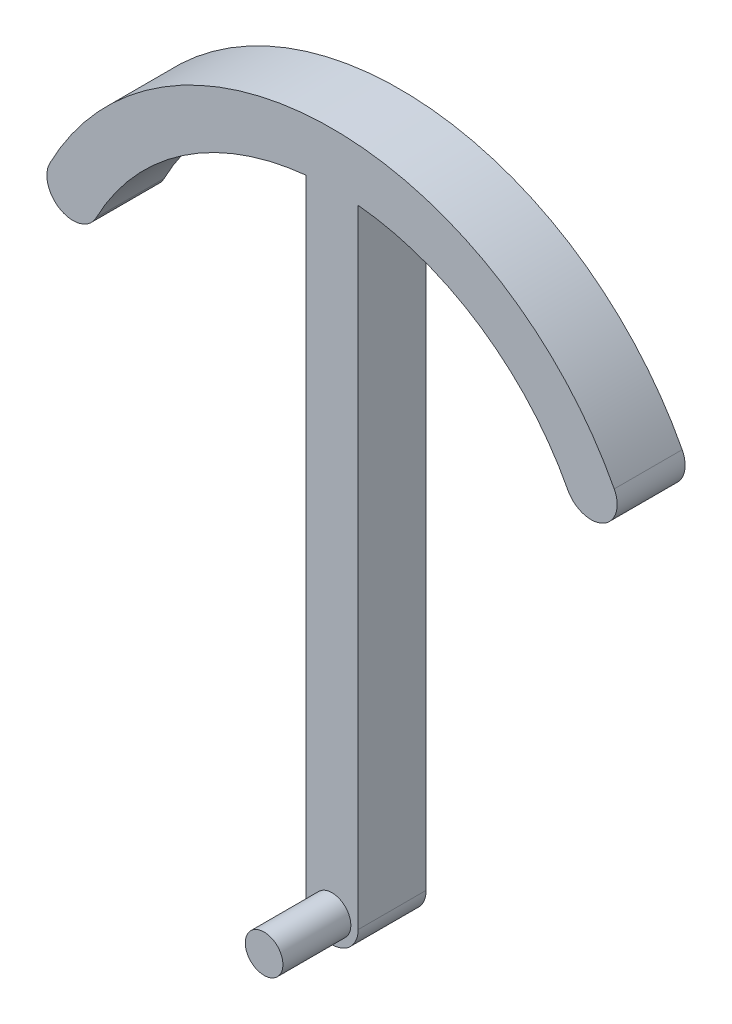
from build123d import *

# Parameters (mm, degrees)
BOSS_EXTRUDE1_DEPTH = 8.255
SKETCH2_R           = 2.286
BOSS_EXTRUDE2_DEPTH = 8.255


with BuildPart() as part:
    # Sketch1 → Boss-Extrude1 (new body)
    with BuildSketch(Plane.XY):
        with BuildLine():
            Line((-3.175, 0), (-3.175, 76.2))
            ThreePointArc((-3.175, 76.2), (-18.093218198, 70.815414406), (-28.651936534, 58.980700074))
            ThreePointArc((-28.651936534, 58.980700074), (-32.93498772, 57.632841574), (-34.28284622, 61.91589276))
            ThreePointArc((-34.28284622, 61.91589276), (0, 82.706372545), (34.28284622, 61.91589276))
            ThreePointArc((34.28284622, 61.91589276), (32.93498772, 57.632841574), (28.651936534, 58.980700074))
            ThreePointArc((28.651936534, 58.980700074), (18.093218198, 70.815414406), (3.175, 76.2))
            Line((3.175, 76.2), (3.175, 0))
            ThreePointArc((3.175, 0), (0, -3.175), (-3.175, 0))
        make_face()
    extrude(amount=BOSS_EXTRUDE1_DEPTH)

    # Sketch2 → Boss-Extrude2 (add)
    with BuildSketch(Plane.XY.offset(8.255)):
        Circle(SKETCH2_R)
    extrude(amount=BOSS_EXTRUDE2_DEPTH)


solid = part.part
